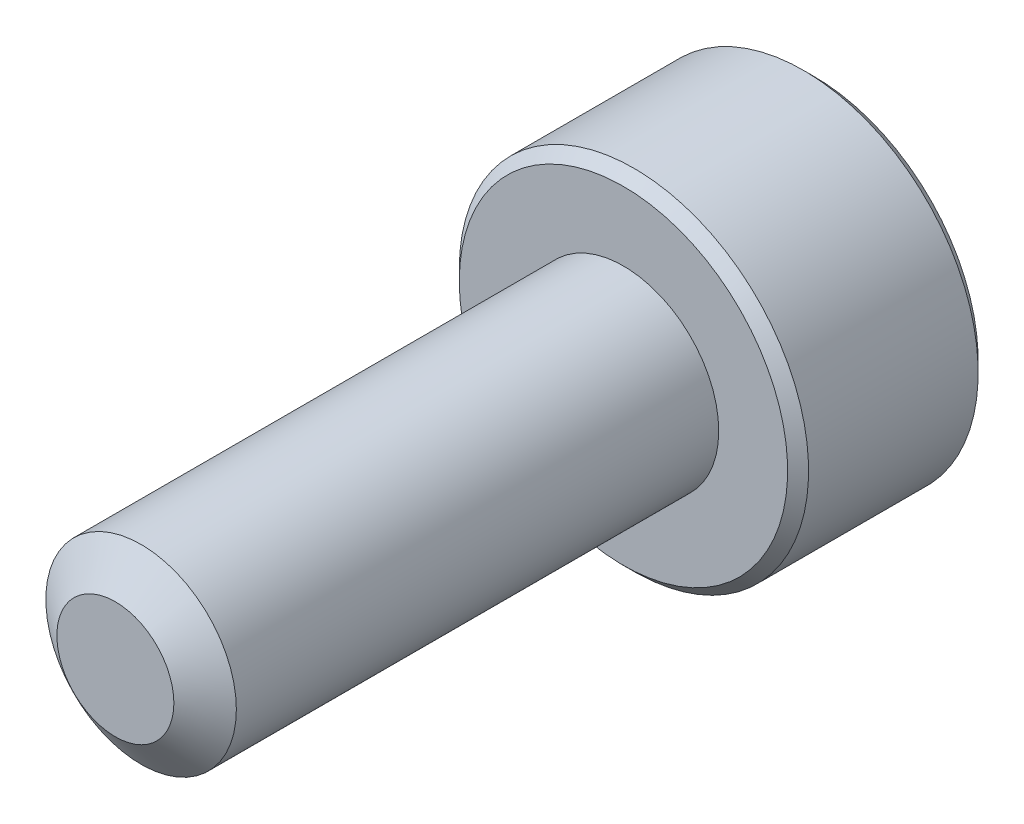
from build123d import *

# Parameters (mm, degrees)
SKETCH1_R          = 1.5
EXTRUDE1_DEPTH     = 8
SKETCH6_R          = 2.75
EXTRUDE2_DEPTH     = 3
CUT_EXTRUDE1_DEPTH = 1.875
CHAMFER1_SIZE      = 0.165


with BuildPart() as part:
    # Sketch1 → Extrude1 (new body)
    with BuildSketch(Plane.XY):
        Circle(SKETCH1_R)
    extrude(amount=-EXTRUDE1_DEPTH)

    # Sketch4 → Cut-Revolve1 (revolve, cut)
    with BuildSketch(Plane(origin=(0, 0, 0), x_dir=(0, 0, -1), z_dir=(1, 0, 0))):
        Polygon((0.405251783, 1.5), (0, 0.921240474), (0, 1.5), align=None)
    revolve(axis=Axis((0, 0, 0), (0, 0, -1)), mode=Mode.SUBTRACT)

    # Sketch6 → Extrude2 (add)
    with BuildSketch(Plane(origin=(0, 0, -8), x_dir=(-1, 0, 0), z_dir=(0, 0, -1))):
        Circle(SKETCH6_R)
    extrude(amount=EXTRUDE2_DEPTH)

    # Sketch7 → Cut-Extrude1 (cut)
    with BuildSketch(Plane(origin=(0, 0, -11), x_dir=(-1, 0, 0), z_dir=(0, 0, -1))):
        Polygon((0, 1.443375673), (-1.25, 0.721687836), (-1.25, -0.721687836), (0, -1.443375673), (1.25, -0.721687836), (1.25, 0.721687836), align=None)
    extrude(amount=-CUT_EXTRUDE1_DEPTH, mode=Mode.SUBTRACT)

    # Cut-Extrude2 cone 1 section (through the dimple's axis) → Cut-Extrude2 (revolve, cut)
    with BuildSketch(Plane(origin=(0, 0, -11), x_dir=(0, 1, 0), z_dir=(1, 0, 0))):
        Polygon((0, 0), (1.443375673, 0), (0, 1.443375673), align=None)
    revolve(axis=Axis((0, 0, -11), (0, 0, 1)), mode=Mode.SUBTRACT)

    # Chamfer1
    chamfer1_edges = [part.edges().sort_by_distance(p)[0] for p in [
        (2.75, 0, -11),
        (2.75, 0, -8),
    ]]
    chamfer(chamfer1_edges, length=CHAMFER1_SIZE)


solid = part.part
